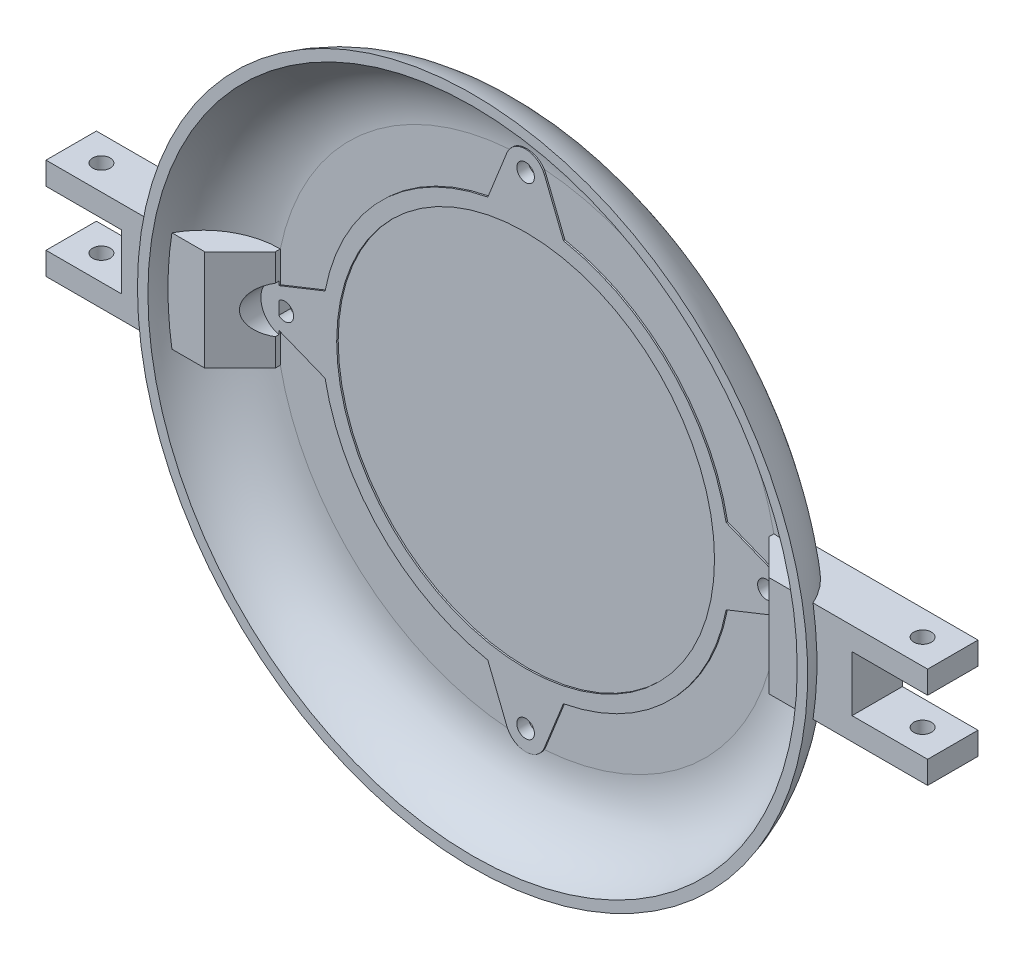
from build123d import *

# Parameters (mm, degrees)
SKETCH1_R           = 50
BOSS_EXTRUDE1_DEPTH = 2
SKETCH4_R           = 40.5
SKETCH4_R_2         = 37.5
BOSS_EXTRUDE4_DEPTH = 0.3
SKETCH5_R           = 1.75
BOSS_EXTRUDE5_DEPTH = 0.3
CIRPATTERN1_COUNT   = 4
SKETCH6_R           = 1.75
CUT_EXTRUDE1_DEPTH  = 74.282848466
SKETCH9_W           = 38.510205144
SKETCH9_H           = 20
BOSS_EXTRUDE6_DEPTH = 10
CHAMFER1_SIZE       = 7
SKETCH11_R          = 4.75
CUT_EXTRUDE4_DEPTH  = 111.41866135
SKETCH12_W          = 30
SKETCH12_H          = 11
CUT_EXTRUDE5_DEPTH  = 111.369568379
SKETCH13_R          = 1.75
CUT_EXTRUDE6_DEPTH  = 117.946320711


# Read off the part's stored shape, not the designer's step: Mirror1
with BuildPart() as part:
    # Sketch1 → Boss-Extrude1 (new body)
    with BuildSketch(Plane.XY):
        Circle(SKETCH1_R)
    extrude(amount=BOSS_EXTRUDE1_DEPTH)

    # Sketch4 → Boss-Extrude4 (add)
    with BuildSketch(Plane.XY.offset(2)):
        Circle(SKETCH4_R)
        Circle(SKETCH4_R_2, mode=Mode.SUBTRACT)
    extrude(amount=BOSS_EXTRUDE4_DEPTH)

    # Sketch5 → Boss-Extrude5 (add)
    with BuildSketch(Plane.XY.offset(2)):
        with BuildLine():
            Line((-7.5, 39.799497484), (7.5, 39.799497484))
            Line((7.5, 39.799497484), (3.715004122, 49.282313849))
            ThreePointArc((3.715004122, 49.282313849), (0, 51.799497484), (-3.715004122, 49.282313849))
            Line((-3.715004122, 49.282313849), (-7.5, 39.799497484))
        make_face()
        with Locations((0, 47.799497484)):
            Circle(SKETCH5_R, mode=Mode.SUBTRACT)
    boss_extrude5 = extrude(amount=BOSS_EXTRUDE5_DEPTH)

    # CirPattern1: Boss-Extrude5 ×4 about axis
    cirpattern1_axis = Axis((0, 0, 0), (0, 0, 1))
    for i in range(1, CIRPATTERN1_COUNT):
        add(boss_extrude5.rotate(cirpattern1_axis, i * 360 / CIRPATTERN1_COUNT))

    # Sketch6 → Cut-Extrude1 (cut, through all)
    with BuildSketch(Plane.XY.offset(2)):
        with Locations((0, 47.799497484)):
            Circle(SKETCH6_R)
        with Locations(Location((-47.799497484, 0, 0), (0, 0, 90))):
            Circle(SKETCH6_R)
        with Locations(Location((47.799497484, 0, 0), (0, 0, 270))):
            Circle(SKETCH6_R)
        with Locations(Location((0, -47.799497484, 0), (0, 0, 180))):
            Circle(SKETCH6_R)
    extrude(amount=-CUT_EXTRUDE1_DEPTH, mode=Mode.SUBTRACT)

    # Sketch7 → Revolve1 (revolve)
    with BuildSketch(Plane(origin=(0, 0, 0), x_dir=(1, 0, 0), z_dir=(0, 1, 0)), mode=Mode.PRIVATE) as revolve1_sk:
        with BuildLine():
            Line((64.448674588, -12.82801739), (66.522113551, -12.82801739))
            ThreePointArc((66.522113551, -12.82801739), (60.458707692, -3.583498189), (50, 0))
            Line((50, 0), (50, -2))
            ThreePointArc((50, -2), (59.027875691, -5.00740567), (64.448674588, -12.82801739))
        make_face()
    revolve(revolve1_sk.sketch.rotate(Axis((0, 0, 0), (0, 0, 1)), 180), axis=Axis((0, 0, 0), (0, 0, 1)))

    # Sketch9 → Boss-Extrude6 (add)
    with BuildSketch(Plane.XY):
        with Locations((-68.244897428, 0)):
            Rectangle(SKETCH9_W, SKETCH9_H)
    extrude(amount=BOSS_EXTRUDE6_DEPTH)

    # Chamfer1
    chamfer1_edges = [part.edges().sort_by_distance(p)[0] for p in [
        (-48.989794856, 0, 10),
    ]]
    chamfer(chamfer1_edges, length=CHAMFER1_SIZE)

    # Sketch11 → Cut-Extrude4 (cut, through all)
    with BuildSketch(Plane.XY.offset(2.3)):
        with Locations((-47.799497484, 0)):
            Circle(SKETCH11_R)
    extrude(amount=CUT_EXTRUDE4_DEPTH, mode=Mode.SUBTRACT)

    # Sketch12 → Cut-Extrude5 (cut, through all)
    with BuildSketch(Plane.XY.offset(10)):
        with Locations((-87.5, 0)):
            Rectangle(SKETCH12_W, SKETCH12_H)
    extrude(amount=-CUT_EXTRUDE5_DEPTH, mode=Mode.SUBTRACT)

    # Sketch13 → Cut-Extrude6 (cut, through all)
    with BuildSketch(Plane.XZ.offset(10)):
        with Locations((-81.5, 5)):
            Circle(SKETCH13_R)
    extrude(amount=-CUT_EXTRUDE6_DEPTH, mode=Mode.SUBTRACT)

    # Mirror1: part across plane


with BuildPart() as part_1:
    add(part.part)
    add(part.part.mirror(Plane(origin=(0, 0, 0), x_dir=(0, 0, 1), z_dir=(1, 0, 0))))


solid = part_1.part
